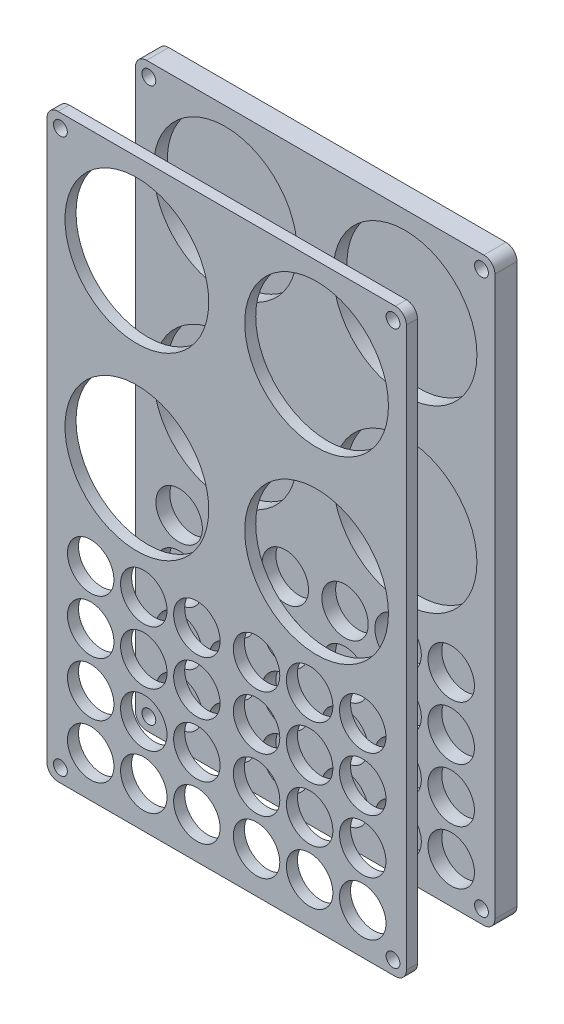
from build123d import *

# Parameters (mm, degrees)
SKETCH1_W                          = 210
SKETCH1_H                          = 130
F_120_X_200_X_67_TH_DEPTH          = 40
SKETCH2_R                          = 26
SKETCH2_R_2                        = 8.4
F_16_8_D_AND_52_D_TUBE_HOLES_DEPTH = 37
F_4_MM_R_FILET_R                   = 4
PLATE_SEPERATING_CUT_DEPTH         = 130.807549857
PLATE_SEPERATING_CUT_DEPTH_BACK    = 130.807549857
SKETCH3_W                          = 210
SKETCH3_H                          = 28
M4_THROUGH_HOLES_DEPTH             = 130.807549857
M4_THROUGH_HOLES_DEPTH_BACK        = 130.807549857
SKETCH2_3_R                        = 2.5


with BuildPart() as part:
    # Sketch1 → 120 x 200 x 67 th (new body)
    with BuildSketch(Plane(origin=(0, 0, 0), x_dir=(0, 1, 0), z_dir=(0, 0, 1))):
        Rectangle(SKETCH1_W, SKETCH1_H)
    extrude(amount=F_120_X_200_X_67_TH_DEPTH)

    # Sketch2 → 16.8 D and 52 D tube holes (cut)
    with BuildSketch(Plane.XY.offset(40)):
        with Locations((-32.5, 72.5)):
            Circle(SKETCH2_R)
        with Locations((10.8, -31.641617153)):
            Circle(SKETCH2_R_2)
        with Locations((30, -31.641617153)):
            Circle(SKETCH2_R_2)
        with Locations((49.2, -31.641617153)):
            Circle(SKETCH2_R_2)
        with Locations((-10.8, -31.641617153)):
            Circle(SKETCH2_R_2)
        with Locations((-30, -31.641617153)):
            Circle(SKETCH2_R_2)
        with Locations((-49.2, -31.641617153)):
            Circle(SKETCH2_R_2)
        with Locations((10.8, -51.141617153)):
            Circle(SKETCH2_R_2)
        with Locations((30, -51.141617153)):
            Circle(SKETCH2_R_2)
        with Locations((49.2, -51.141617153)):
            Circle(SKETCH2_R_2)
        with Locations((-10.8, -51.141617153)):
            Circle(SKETCH2_R_2)
        with Locations((-30, -51.141617153)):
            Circle(SKETCH2_R_2)
        with Locations((-49.2, -51.141617153)):
            Circle(SKETCH2_R_2)
        with Locations((10.8, -70.641617153)):
            Circle(SKETCH2_R_2)
        with Locations((30, -70.641617153)):
            Circle(SKETCH2_R_2)
        with Locations((49.2, -70.641617153)):
            Circle(SKETCH2_R_2)
        with Locations((-10.8, -70.641617153)):
            Circle(SKETCH2_R_2)
        with Locations((-30, -70.641617153)):
            Circle(SKETCH2_R_2)
        with Locations((-49.2, -70.641617153)):
            Circle(SKETCH2_R_2)
        with Locations((10.8, -90.141617153)):
            Circle(SKETCH2_R_2)
        with Locations((30, -90.141617153)):
            Circle(SKETCH2_R_2)
        with Locations((49.2, -90.141617153)):
            Circle(SKETCH2_R_2)
        with Locations((-10.8, -90.141617153)):
            Circle(SKETCH2_R_2)
        with Locations((-30, -90.141617153)):
            Circle(SKETCH2_R_2)
        with Locations((-49.2, -90.141617153)):
            Circle(SKETCH2_R_2)
        with Locations((32.5, 72.5)):
            Circle(SKETCH2_R)
        with Locations((32.5, 7.5)):
            Circle(SKETCH2_R)
        with Locations((-32.5, 7.5)):
            Circle(SKETCH2_R)
    extrude(amount=-F_16_8_D_AND_52_D_TUBE_HOLES_DEPTH, mode=Mode.SUBTRACT)

    # 4 mm R filet
    f_4_mm_r_filet_edges = [part.edges().sort_by_distance(p)[0] for p in [
        (-65, 105, 20),
        (65, 105, 20),
        (-65, -105, 20),
        (65, -105, 20),
    ]]
    fillet(f_4_mm_r_filet_edges, radius=F_4_MM_R_FILET_R)

    # Sketch3 → Plate Seperating cut (cut, two sides: drawn at the far end of the back side and taken through both)
    with BuildSketch(Plane.YZ.offset(-PLATE_SEPERATING_CUT_DEPTH_BACK)):
        with Locations((0, 22)):
            Rectangle(SKETCH3_W, SKETCH3_H)
    extrude(amount=PLATE_SEPERATING_CUT_DEPTH + PLATE_SEPERATING_CUT_DEPTH_BACK, mode=Mode.SUBTRACT)


with BuildPart() as plate_seperating_cut_piece_1:
    # of the separate pieces the step leaves, piece 1, a body of its own (plate_seperating_cut_pieces)
    add(part.part.solids().sort_by_distance((65, -101, 0))[0])


with BuildPart() as plate_seperating_cut_piece_2:
    # of the separate pieces the step leaves, piece 2, a body of its own (plate_seperating_cut_pieces)
    add(part.part.solids().sort_by_distance((65, 101, 36))[0])


with BuildPart() as m4_through_holes_tool:
    # Sketch2<3> → M4 through holes (new, two sides: drawn at the far end of the back side and taken through both)
    with BuildSketch(Plane.XY.offset(40).offset(-M4_THROUGH_HOLES_DEPTH_BACK)):
        with Locations((-60.158155916, -100.158155916)):
            Circle(SKETCH2_3_R)
        with Locations((-60.158155916, 100.158155916)):
            Circle(SKETCH2_3_R)
        with Locations((60.158155916, -100.158155916)):
            Circle(SKETCH2_3_R)
        with Locations((60.158155916, 100.158155916)):
            Circle(SKETCH2_3_R)
    extrude(amount=M4_THROUGH_HOLES_DEPTH + M4_THROUGH_HOLES_DEPTH_BACK)


with BuildPart() as plate_seperating_cut_piece_1_1:
    add(plate_seperating_cut_piece_1.part)

    # M4 through holes: cut by m4_through_holes_tool
    add(m4_through_holes_tool.part, mode=Mode.SUBTRACT)


with BuildPart() as plate_seperating_cut_piece_2_1:
    add(plate_seperating_cut_piece_2.part)

    # M4 through holes: cut by m4_through_holes_tool
    add(m4_through_holes_tool.part, mode=Mode.SUBTRACT)


solid = Compound([plate_seperating_cut_piece_1_1.part, plate_seperating_cut_piece_2_1.part])
